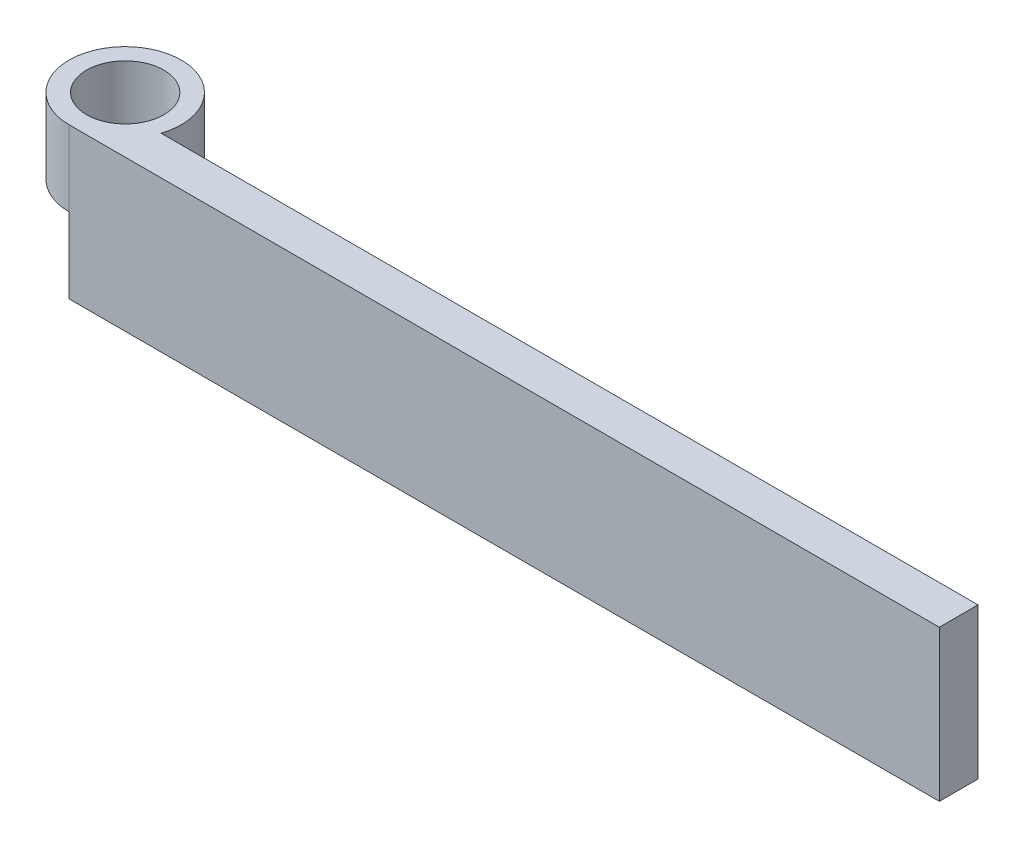
from build123d import *

# Parameters (mm, degrees)
CROQUIS1_R                   = 2.9
CROQUIS1_R_2                 = 2
SALIENTE_EXTRUIR1_DEPTH      = 3.9
SALIENTE_EXTRUIR2_DEPTH      = 3.9
SALIENTE_EXTRUIR2_DEPTH_BACK = 3.9


with BuildPart() as part:
    # Croquis1 → Saliente-Extruir1 (new body)
    with BuildSketch(Plane(origin=(0, 0, 0), x_dir=(1, 0, 0), z_dir=(0, 1, 0))):
        Circle(CROQUIS1_R)
        Circle(CROQUIS1_R_2, mode=Mode.SUBTRACT)
    extrude(amount=SALIENTE_EXTRUIR1_DEPTH)

    # Croquis3 → Saliente-Extruir2 (add, two sides: drawn at the far end of the back side and taken through both)
    with BuildSketch(Plane.XZ.offset(-SALIENTE_EXTRUIR2_DEPTH_BACK)):
        with BuildLine():
            Line((45, 2.9), (0, 2.9))
            ThreePointArc((0, 2.9), (1.702938637, 2.347338919), (2.75680975, 0.9))
            Line((2.75680975, 0.9), (45, 0.9))
            Line((45, 0.9), (45, 2.9))
        make_face()
    extrude(amount=SALIENTE_EXTRUIR2_DEPTH + SALIENTE_EXTRUIR2_DEPTH_BACK)


solid = part.part
